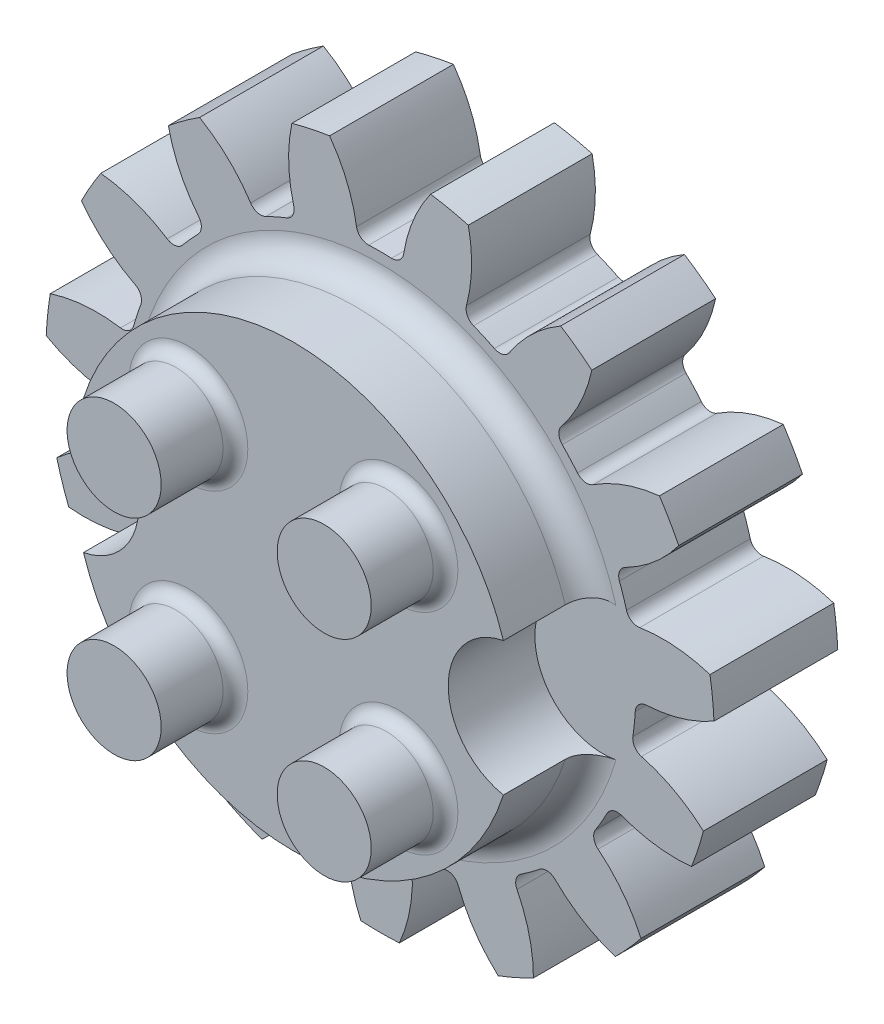
from build123d import *

# Parameters (mm, degrees)
SKETCH1_R                      = 13.5
BOSS_EXTRUDE1_DEPTH            = 2.5
CUT_EXTRUDE1_DEPTH             = 20.254869514
FILLET2_R                      = 0.476470588
CIRPATTERN1_COUNT              = 15
FILLET2_OF_CIRPATTERN1_R       = 0.476470588
THROUGH_CENTER_HOLE_DEPTH      = 20.244419741
THROUGH_CENTER_HOLE_DEPTH_BACK = 20.244419741
SKETCH5_R                      = 1.25
BOSS_EXTRUDE2_DEPTH            = 3.5
SKETCH7_R                      = 1.9
BOSS_EXTRUDE3_DEPTH            = 3
FILLET3_R                      = 1
FILLET4_R                      = 0.5


with BuildPart() as part:
    # Sketch1 → Boss-Extrude1 (new, symmetric)
    with BuildSketch(Plane.XY):
        Circle(SKETCH1_R)
    extrude(amount=BOSS_EXTRUDE1_DEPTH, both=True)

    # Sketch3 → Cut-Extrude1 (cut, symmetric)
    with BuildSketch(Plane.XY):
        with BuildLine():
            ThreePointArc((-2.040384037, 13.344917871), (-1.26191316, 11.892090906), (-0.898861073, 10.284323424))
            ThreePointArc((-0.898861073, 10.284323424), (0, 10.323529412), (0.898861073, 10.284323424))
            ThreePointArc((0.898861073, 10.284323424), (1.26191316, 11.892090906), (2.040384037, 13.344917871))
            ThreePointArc((2.040384037, 13.344917871), (0, 13.5), (-2.040384037, 13.344917871))
        make_face()
    cut_extrude1 = extrude(amount=CUT_EXTRUDE1_DEPTH, both=True, mode=Mode.SUBTRACT)

    # Fillet2
    fillet2_edges = [part.edges().sort_by_distance(p)[0] for p in [
        (0.898861073, 10.284323424, 0),
        (-0.898861073, 10.284323424, 0),
    ]]
    fillet(fillet2_edges, radius=FILLET2_R)

    # CirPattern1: Cut-Extrude1 ×15 about axis
    cirpattern1_axis = Axis((0, 0, 0), (0, 0, 1))
    for i in range(1, CIRPATTERN1_COUNT):
        add(cut_extrude1.rotate(cirpattern1_axis, i * 360 / CIRPATTERN1_COUNT), mode=Mode.SUBTRACT)

    # Fillet2 of CirPattern1
    fillet2_of_cirpattern1_edges = [part.edges().sort_by_distance(p)[0] for p in [
        (-3.361860735, 9.760796684, 0),
        (-5.004161636, 9.029597213, 0),
        (-7.041286281, 7.549539524, 0),
        (-8.244197191, 6.213571613, 0),
        (-9.503209461, 4.032898395, 0),
        (-10.058736155, 2.323163032, 0),
        (-10.321941391, -0.181067505, 0),
        (-10.134028257, -1.968941542, 0),
        (-9.355915883, -4.363725188, 0),
        (-8.457054809, -5.920598236, 0),
        (-6.772167522, -7.791855143, 0),
        (-5.317779754, -8.848529708, 0),
        (-3.017449874, -9.872702557, 0),
        (-1.25901227, -10.246470008, 0),
        (1.25901227, -10.246470008, 0),
        (3.017449874, -9.872702557, 0),
        (5.317779754, -8.848529708, 0),
        (6.772167522, -7.791855143, 0),
        (8.457054809, -5.920598236, 0),
        (9.355915883, -4.363725188, 0),
        (10.134028257, -1.968941542, 0),
        (10.321941391, -0.181067505, 0),
        (10.058736155, 2.323163032, 0),
        (9.503209461, 4.032898395, 0),
        (8.244197191, 6.213571613, 0),
        (7.041286281, 7.549539524, 0),
        (5.004161636, 9.029597213, 0),
        (3.361860735, 9.760796684, 0),
    ]]
    fillet(fillet2_of_cirpattern1_edges, radius=FILLET2_OF_CIRPATTERN1_R)

    # Sketch5 → Through_Center_Hole (cut, two sides: drawn at the far end of the back side and taken through both)
    with BuildSketch(Plane.XY.offset(-THROUGH_CENTER_HOLE_DEPTH_BACK)):
        Circle(SKETCH5_R)
    extrude(amount=THROUGH_CENTER_HOLE_DEPTH + THROUGH_CENTER_HOLE_DEPTH_BACK, mode=Mode.SUBTRACT)

    # Sketch6 → Boss-Extrude2 (add)
    with BuildSketch(Plane.XY.offset(2.5)):
        with BuildLine():
            ThreePointArc((-8.480416667, -2.700469063), (-6.25, 0), (-8.480416667, 2.700469063))
            ThreePointArc((-8.480416667, 2.700469063), (0, 8.9), (8.480416667, 2.700469063))
            ThreePointArc((8.480416667, 2.700469063), (6.25, 0), (8.480416667, -2.700469063))
            ThreePointArc((8.480416667, -2.700469063), (0, -8.9), (-8.480416667, -2.700469063))
        make_face()
    extrude(amount=BOSS_EXTRUDE2_DEPTH)

    # Sketch7 → Boss-Extrude3 (add)
    with BuildSketch(Plane.XY.offset(6)):
        with Locations((-4.242640687, 4.242640687)):
            Circle(SKETCH7_R)
        with Locations((4.242640687, 4.242640687)):
            Circle(SKETCH7_R)
        with Locations((4.242640687, -4.242640687)):
            Circle(SKETCH7_R)
        with Locations((-4.242640687, -4.242640687)):
            Circle(SKETCH7_R)
    extrude(amount=BOSS_EXTRUDE3_DEPTH)

    # Fillet3
    # the kernel refuses this fillet: 1 mm, written as the material it adds along each edge
    with BuildSketch(Plane(origin=(0, 0, 2.5), x_dir=(0.9996330098529925, -0.02708958494047193, 0), z_dir=(0.02708958494047193, 0.9996330098529925, 0))) as fillet3_piece_1_section:
        with BuildLine():
            CenterArc((8.9 + FILLET3_R, -FILLET3_R), FILLET3_R, 90, 90)
            Line((8.9, -FILLET3_R), (8.9, 0))
            Line((8.9, 0), (8.9 + FILLET3_R, 0))
        make_face()
    fillet3_piece_1 = revolve(axis=Axis((0, 0, 2.5), (0, 0, -1)), revolution_arc=176.895382431, mode=Mode.PRIVATE)
    fillet3_piece_1 = fillet3_piece_1 - Plane(origin=(9, 0, 2.780116287), x_dir=(-0.18893939393939513, 0.9819887501482969, 0), z_dir=(0, 0, -1)) * Cylinder(2.75, 40, mode=Mode.PRIVATE)
    fillet3_piece_1 = fillet3_piece_1 - Plane(origin=(-9, 0, 2.780116287), x_dir=(0.18893939393939513, -0.9819887501482969, 0), z_dir=(0, 0, -1)) * Cylinder(2.75, 40, mode=Mode.PRIVATE)
    add(fillet3_piece_1)
    with BuildSketch(Plane(origin=(0, 0, 2.5), x_dir=(-0.9996330098529925, 0.027089584940471288, 0), z_dir=(-0.027089584940471288, -0.9996330098529925, 0))) as fillet3_piece_2_section:
        with BuildLine():
            CenterArc((8.9 + FILLET3_R, -FILLET3_R), FILLET3_R, 90, 90)
            Line((8.9, -FILLET3_R), (8.9, 0))
            Line((8.9, 0), (8.9 + FILLET3_R, 0))
        make_face()
    fillet3_piece_2 = revolve(axis=Axis((0, 0, 2.5), (0, 0, -1)), revolution_arc=176.895382431, mode=Mode.PRIVATE)
    fillet3_piece_2 = fillet3_piece_2 - Plane(origin=(9, 0, 2.780116287), x_dir=(-0.18893939393939513, 0.9819887501482969, 0), z_dir=(0, 0, -1)) * Cylinder(2.75, 40, mode=Mode.PRIVATE)
    fillet3_piece_2 = fillet3_piece_2 - Plane(origin=(-9, 0, 2.780116287), x_dir=(0.18893939393939513, -0.9819887501482969, 0), z_dir=(0, 0, -1)) * Cylinder(2.75, 40, mode=Mode.PRIVATE)
    add(fillet3_piece_2)

    # Fillet4
    fillet4_edges = [part.edges().sort_by_distance(p)[0] for p in [
        (-6.142640687, 4.242640687, 6),
        (2.342640687, 4.242640687, 6),
        (2.342640687, -4.242640687, 6),
        (-6.142640687, -4.242640687, 6),
    ]]
    fillet(fillet4_edges, radius=FILLET4_R)


solid = part.part
